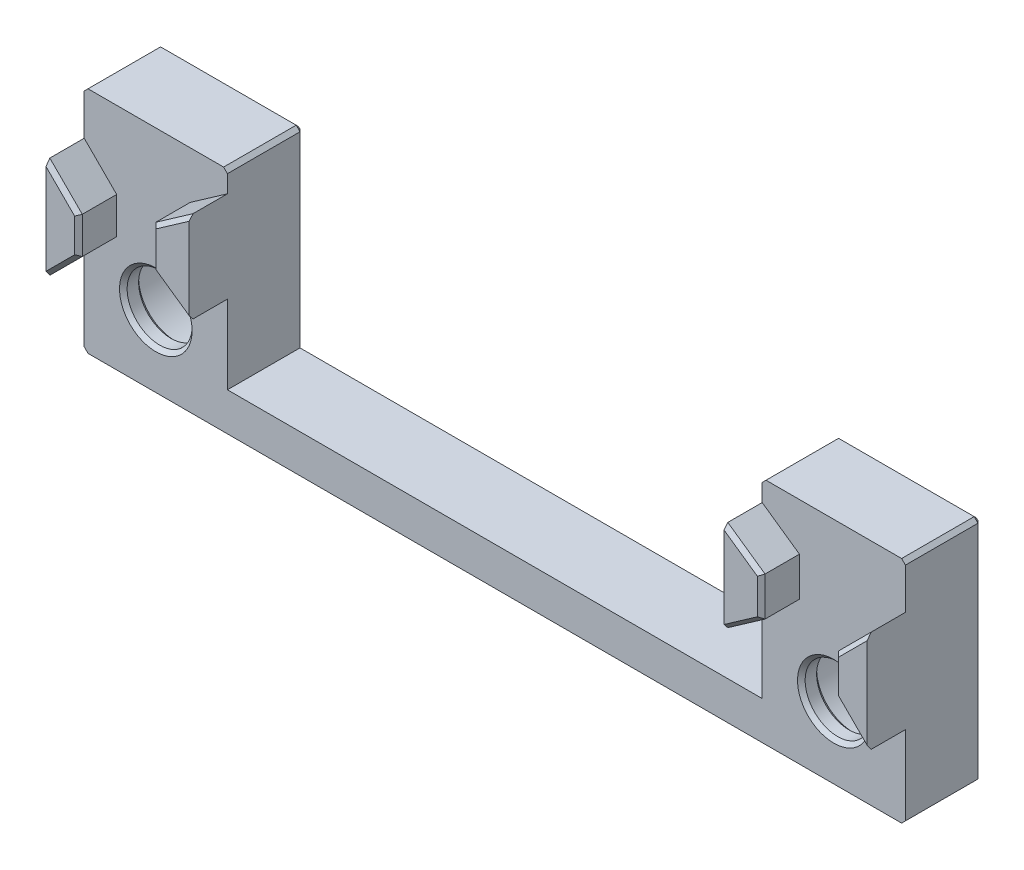
from build123d import *

# Parameters (mm, degrees)
BOSS_EXTRUDE1_DEPTH            = 4
SLOT_ALIGNER_DEPTH             = 2
ALIGNER_DEPTH                  = 2
DEBURS_SIZE                    = 0.2
CBORE_FOR_M3_SHCS1_D           = 3.4
CBORE_FOR_M3_SHCS1_CBORE_D     = 6.5
CBORE_FOR_M3_SHCS1_CBORE_DEPTH = 3
CHAMFER1_SIZE                  = 0.2


with BuildPart() as part:
    # Sketch1 → Boss-Extrude1 (new body)
    with BuildSketch(Plane.XY):
        Polygon((-21.3, -6), (21.3, -6), (21.5, -5.8), (21.5, 5.8), (21.3, 6), (14.2, 6), (14, 5.8), (14, -4), (-14, -4), (-14, 5.8), (-14.2, 6), (-21.3, 6), (-21.5, 5.8), (-21.5, -5.8), align=None)
    extrude(amount=-BOSS_EXTRUDE1_DEPTH)

    # Sketch3 → Slot Aligner (add)
    with BuildSketch(Plane.XY):
        Polygon((14, 4.887353977), (14, 0.112646023), (15.95, 1.478050722), (15.95, 3.521949278), align=None)
    slot_aligner = extrude(amount=SLOT_ALIGNER_DEPTH)

    # Mirror3: Slot Aligner across plane
    add(slot_aligner.mirror(Plane(origin=(0, 0, 0), x_dir=(0, 0, 1), z_dir=(1, 0, 0))))

    # Sketch4 → Aligner (add)
    with BuildSketch(Plane(origin=(0, 0, 0), x_dir=(-1, 0, 0), z_dir=(0, 0, -1))):
        Polygon((-19.8, 1.958578644), (-21.4, 3.558578644), (-21.5, 3.658578644), (-21.5, -1.658578644), (-21.4, -1.558578644), (-19.8, 0.041421356), align=None)
    aligner = extrude(amount=-ALIGNER_DEPTH)

    # Aligners: Aligner across plane
    add(aligner.mirror(Plane(origin=(0, 0, 0), x_dir=(0, 0, 1), z_dir=(1, 0, 0))))

    # Deburs
    deburs_edges = [part.edges().sort_by_distance(p)[0] for p in [
        (14, 0.9, -4),
        (14.1, 5.9, -4),
        (17.75, 6, -4),
        (21.4, 5.9, -4),
        (21.5, 0, -4),
        (21.4, -5.9, -4),
        (0, -6, -4),
        (-21.4, -5.9, -4),
        (-21.5, 0, -4),
        (-21.4, 5.9, -4),
        (-17.75, 6, -4),
        (-14.1, 5.9, -4),
        (-14, 0.9, -4),
        (0, -4, -4),
        (20.65, -0.808578644, 2),
        (20.65, 2.808578644, 2),
        (19.8, 1, 2),
        (14.975, 4.204651628, 2),
        (15.95, 2.5, 2),
        (14.975, 0.795348372, 2),
        (-14.975, 4.204651628, 2),
        (-15.95, 2.5, 2),
        (-14.975, 0.795348372, 2),
        (-20.65, 2.808578644, 2),
        (-19.8, 1, 2),
        (-20.65, -0.808578644, 2),
    ]]
    chamfer(deburs_edges, length=DEBURS_SIZE)

    # CBORE for M3 SHCS1 (through all)
    with Locations(Plane(origin=(0, 0, -4), x_dir=(-1, 0, 0), z_dir=(0, 0, -1))):
        with Locations((-17.75, -2.25), (17.75, -2.25)):
            CounterBoreHole(CBORE_FOR_M3_SHCS1_D / 2, CBORE_FOR_M3_SHCS1_CBORE_D / 2, CBORE_FOR_M3_SHCS1_CBORE_DEPTH)

    # Chamfer1
    chamfer1_edges = [part.edges().sort_by_distance(p)[0] for p in [
        (-19.45, -2.25, 0),
        (-19.45, -2.25, -1),
        (16.05, -2.25, 0),
        (16.05, -2.25, -1),
        (21, -2.25, -4),
        (-14.5, -2.25, -4),
    ]]
    chamfer(chamfer1_edges, length=CHAMFER1_SIZE)


solid = part.part
